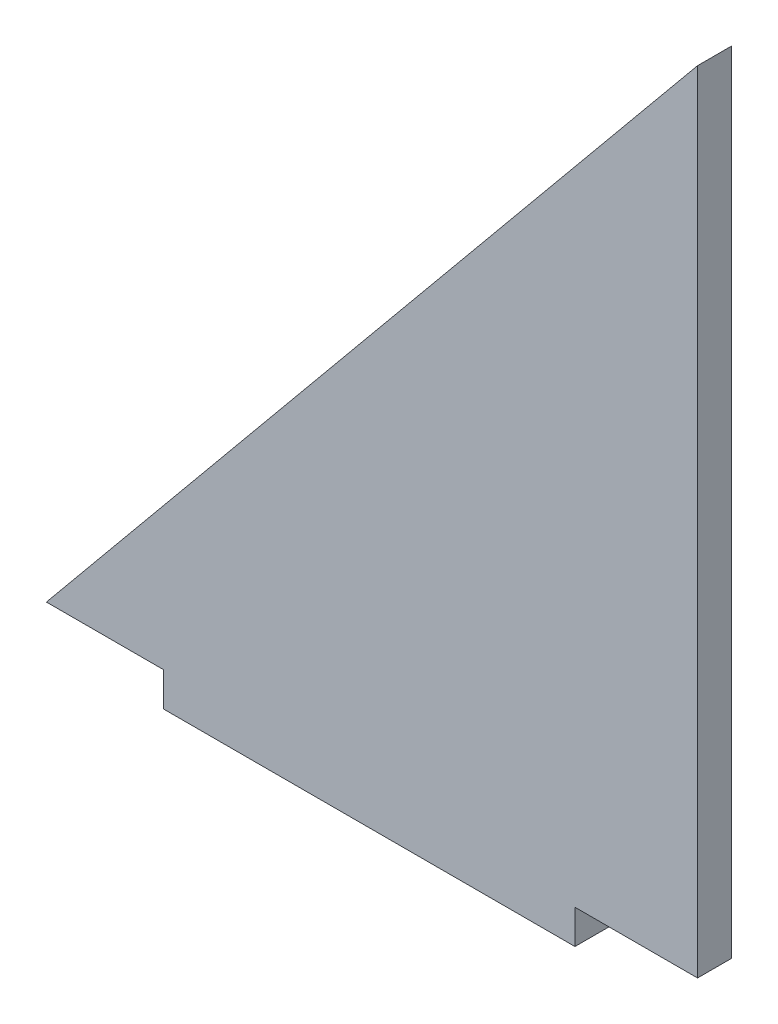
from build123d import *

# Parameters (mm, degrees)
BOSS_EXTRUDE1_DEPTH = 3.175


with BuildPart() as part:
    # Sketch1 → Boss-Extrude1 (new body)
    with BuildSketch(Plane.XY):
        Polygon((-60.706, 0), (0, 73.66), (0, 0), (-11.43, 0), (-11.43, -3.175), (-49.784, -3.175), (-49.784, 0), align=None)
    extrude(amount=BOSS_EXTRUDE1_DEPTH)


solid = part.part
